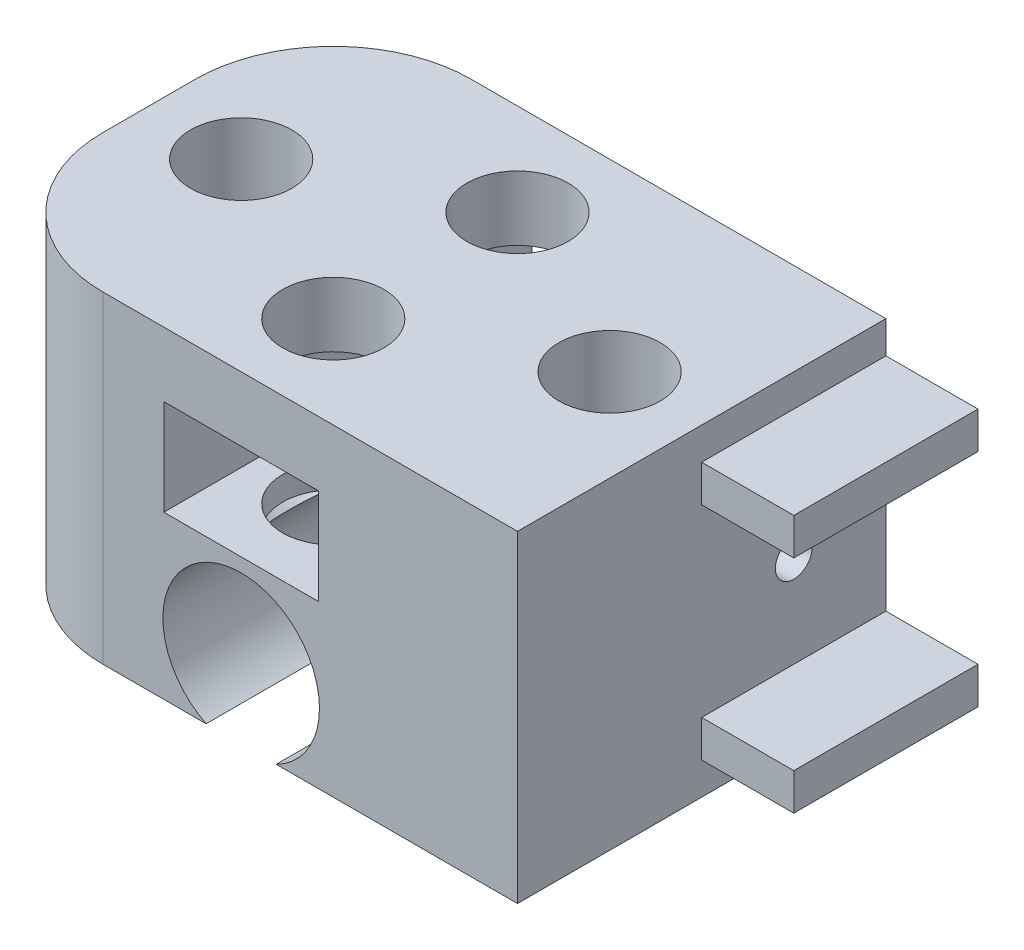
from build123d import *

# Parameters (mm, degrees)
SKETCH1_W                      = 30
SKETCH1_H                      = 17.5
BOSS_EXTRUDE1_DEPTH            = 20
SKETCH2_R                      = 4.25
SKETCH2_W                      = 8.4
SKETCH2_H                      = 5.2
CUT_EXTRUDE1_DEPTH             = 41.078048855
F_5_5_5_5_DIAMETER_HOLE1_D     = 5.5
F_5_5_5_5_DIAMETER_HOLE1_DEPTH = 10
F_5_5_5_5_DIAMETER_HOLE1_TIP   = 1.652366702
F_5_5_5_5_DIAMETER_HOLE2_D     = 5.5
FILLET5_R                      = 7.5
SKETCH12_R                     = 1
CUT_EXTRUDE2_DEPTH             = 8
SKETCH13_W                     = 10
SKETCH13_H                     = 2
BOSS_EXTRUDE2_DEPTH            = 5


with BuildPart() as part:
    # Sketch1 → Boss-Extrude1 (new body)
    with BuildSketch(Plane.XY):
        with Locations((15, 8.75)):
            Rectangle(SKETCH1_W, SKETCH1_H)
    extrude(amount=BOSS_EXTRUDE1_DEPTH)

    # Sketch2 → Cut-Extrude1 (cut, through all)
    with BuildSketch(Plane.XY.offset(20)):
        with Locations((15, 3.8)):
            Circle(SKETCH2_R)
        with Locations((15, 11.4)):
            Rectangle(SKETCH2_W, SKETCH2_H)
    extrude(amount=-CUT_EXTRUDE1_DEPTH, mode=Mode.SUBTRACT)

    # Ø5.5 (5.5) Diameter Hole1
    with Locations(Plane(origin=(0, 17.5, 0), x_dir=(-1, 0, 0), z_dir=(0, 1, 0))):
        with Locations((-15, 15), (-15, 5)):
            Hole(F_5_5_5_5_DIAMETER_HOLE1_D / 2, depth=F_5_5_5_5_DIAMETER_HOLE1_DEPTH)
            with Locations((0, 0, -(F_5_5_5_5_DIAMETER_HOLE1_DEPTH + F_5_5_5_5_DIAMETER_HOLE1_TIP / 2))):  # 118° drill point
                Cone(0, F_5_5_5_5_DIAMETER_HOLE1_D / 2, F_5_5_5_5_DIAMETER_HOLE1_TIP, mode=Mode.SUBTRACT)

    # Ø5.5 (5.5) Diameter Hole2 (through all)
    with Locations(Plane(origin=(0, 17.5, 0), x_dir=(-1, 0, 0), z_dir=(0, 1, 0))):
        with Locations((-25, 10), (-5, 10)):
            Hole(F_5_5_5_5_DIAMETER_HOLE2_D / 2)

    # Fillet5
    fillet5_edges = [part.edges().sort_by_distance(p)[0] for p in [
        (0, 8.75, 0),
        (0, 8.75, 20),
    ]]
    fillet(fillet5_edges, radius=FILLET5_R)

    # Sketch12 → Cut-Extrude2 (cut)
    with BuildSketch(Plane(origin=(30, 0, 0), x_dir=(0, 0, -1), z_dir=(1, 0, 0))):
        with Locations((-5, 8.75)):
            Circle(SKETCH12_R)
    extrude(amount=-CUT_EXTRUDE2_DEPTH, mode=Mode.SUBTRACT)

    # Sketch13 → Boss-Extrude2 (add)
    with BuildSketch(Plane(origin=(30, 0, 0), x_dir=(0, 0, -1), z_dir=(1, 0, 0))):
        with Locations((-5, 14.75)):
            Rectangle(SKETCH13_W, SKETCH13_H)
        with Locations((-5, 2.75)):
            Rectangle(SKETCH13_W, SKETCH13_H)
    extrude(amount=BOSS_EXTRUDE2_DEPTH)


solid = part.part
